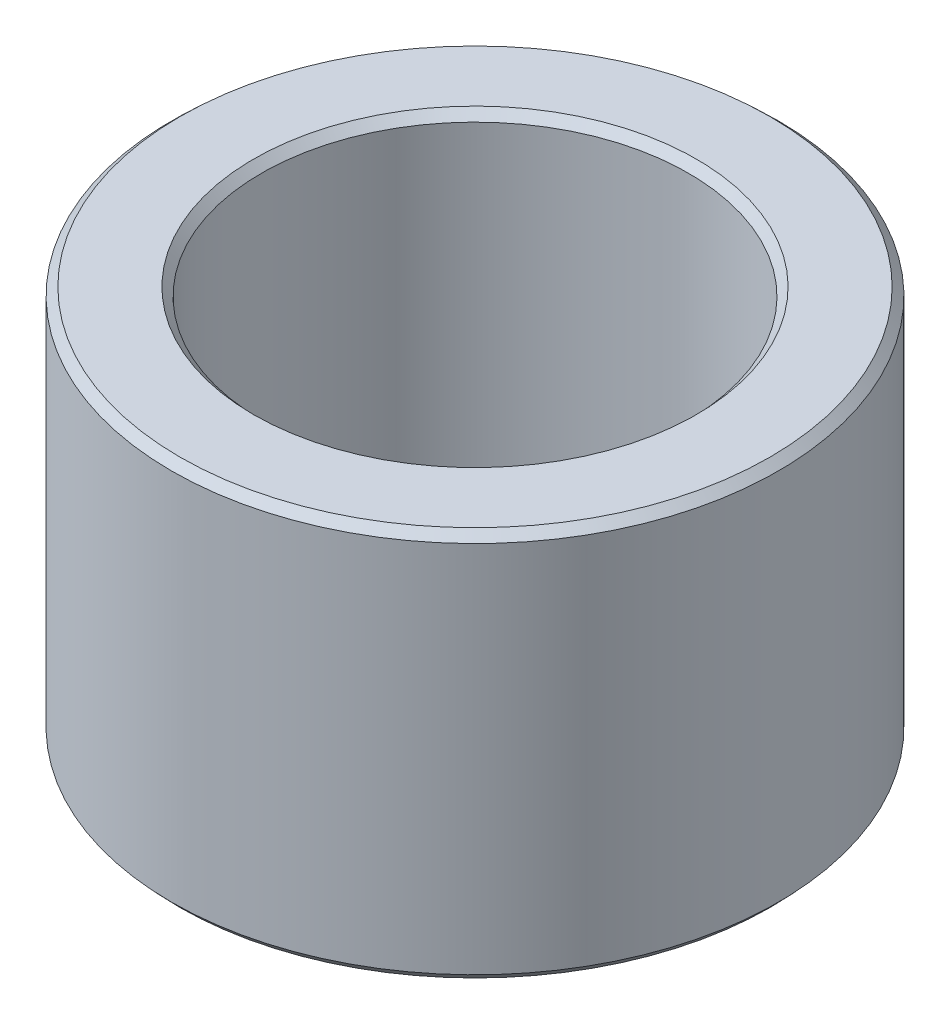
from build123d import *
from OCP.BRepFilletAPI import BRepFilletAPI_MakeChamfer

# Parameters (mm, degrees)
SKETCH1_R           = 12.5
BOSS_EXTRUDE1_DEPTH = 16.05757876
SKETCH2_R           = 8.800375394
CUT_EXTRUDE1_DEPTH  = 24.881914404
CHAMFER1_SIZE       = 0.323722049
CHAMFER1_SIZE2      = 0.343251062


with BuildPart() as part:
    # Sketch1 → Boss-Extrude1 (new body)
    with BuildSketch(Plane(origin=(0, 0, 0), x_dir=(1, 0, 0), z_dir=(0, 1, 0))):
        Circle(SKETCH1_R)
    extrude(amount=BOSS_EXTRUDE1_DEPTH)

    # Sketch2 → Cut-Extrude1 (cut, through all)
    with BuildSketch(Plane(origin=(0, 0, 0), x_dir=(1, 0, 0), z_dir=(0, 1, 0))):
        Circle(SKETCH2_R)
    extrude(amount=CUT_EXTRUDE1_DEPTH, mode=Mode.SUBTRACT)

    # Chamfer1: one chamfer whose edges measure the first distance from different faces: ONE call of the kernel's chamfer builder (chamfer() names one face for all edges)
    chamfer1_edges_1 = [part.edges().sort_by_distance(p)[0] for p in [
        (-8.800375394, 16.05757876, 0),
    ]]
    chamfer1_side_1 = [part.faces().sort_by_distance(p)[0] for p in [
        (-12.146446609, 16.05757876, 0),
    ]]
    chamfer1_edges_2 = [part.edges().sort_by_distance(p)[0] for p in [
        (-8.800375394, 0, 0),
    ]]
    chamfer1_side_2 = [part.faces().sort_by_distance(p)[0] for p in [
        (-8.800375394, 8.02878938, 0),
    ]]
    chamfer1_edges_3 = [part.edges().sort_by_distance(p)[0] for p in [
        (-12.5, 0, 0),
    ]]
    chamfer1_side_3 = [part.faces().sort_by_distance(p)[0] for p in [
        (-12.146446609, 0, 0),
    ]]
    chamfer1_edges_4 = [part.edges().sort_by_distance(p)[0] for p in [
        (-12.5, 16.05757876, 0),
    ]]
    chamfer1_side_4 = [part.faces().sort_by_distance(p)[0] for p in [
        (-12.5, 8.02878938, 0),
    ]]
    chamfer1 = BRepFilletAPI_MakeChamfer(part.part.solid().wrapped)
    for e in chamfer1_edges_1:
        chamfer1.Add(CHAMFER1_SIZE, CHAMFER1_SIZE2, e.wrapped, chamfer1_side_1[0].wrapped)  # the first distance lies on this face
    for e in chamfer1_edges_2:
        chamfer1.Add(CHAMFER1_SIZE, CHAMFER1_SIZE2, e.wrapped, chamfer1_side_2[0].wrapped)  # the first distance lies on this face
    for e in chamfer1_edges_3:
        chamfer1.Add(CHAMFER1_SIZE, CHAMFER1_SIZE2, e.wrapped, chamfer1_side_3[0].wrapped)  # the first distance lies on this face
    for e in chamfer1_edges_4:
        chamfer1.Add(CHAMFER1_SIZE, CHAMFER1_SIZE2, e.wrapped, chamfer1_side_4[0].wrapped)  # the first distance lies on this face
    add(Compound.cast(chamfer1.Shape()), mode=Mode.REPLACE)


solid = part.part
